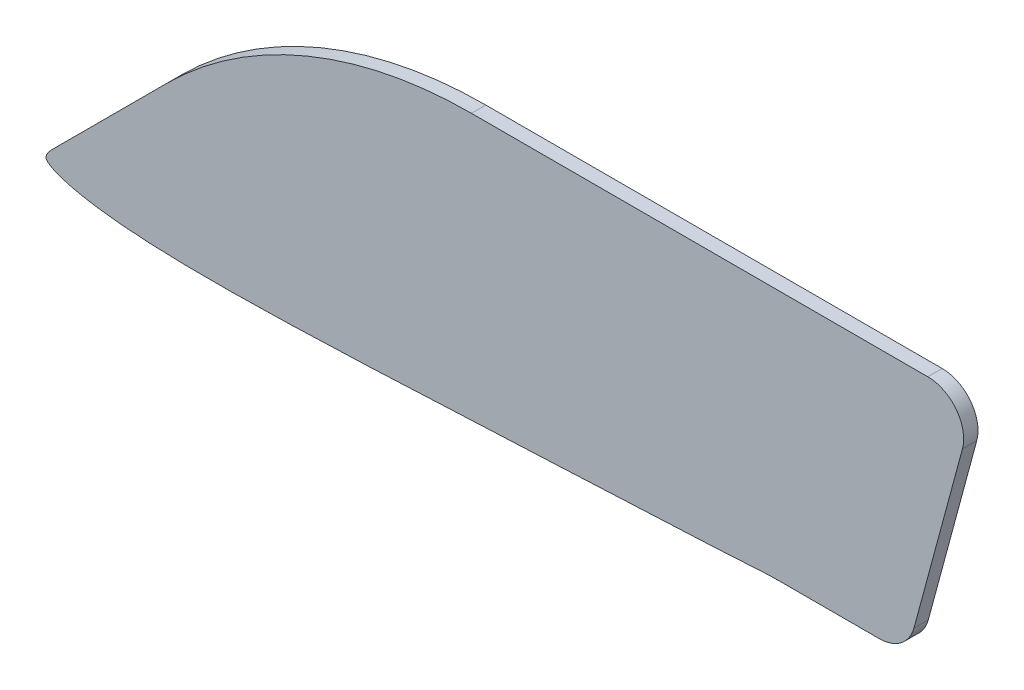
from build123d import *

# Parameters (mm, degrees)
BOSS_EXTRUDE1_DEPTH = 2
FILLET1_R           = 60
FILLET2_R           = 5


with BuildPart() as part:
    # Sketch1 → Boss-Extrude1 (new body)
    with BuildSketch(Plane.XY):
        with BuildLine():
            Line((254.454224585, 35), (220.765620284, 1.3113957))
            add(Edge.make_bspline(
                [(220.765620284, 1.3113957), (220.72663316, 1.272408575), (220.493626624, 1.032206135), (220.23379921, 0.706351654), (220.061642382, 0.318391358), (220.011602189, 0.139502643), (219.995925197, -0.002861211), (220.008120727, -0.115534154), (220.062041002, -0.21843611), (220.160266844, -0.337962224), (220.314496952, -0.477861912), (220.482600839, -0.598911233), (220.942116034, -0.893723302), (221.892375739, -1.29761444), (223.520457756, -1.784013523), (225.623980896, -2.227885385), (228.177131144, -2.613315253), (231.164121123, -2.919183773), (234.563486569, -3.13704422), (238.352012883, -3.267079886), (242.499561211, -3.312040739), (246.9689457, -3.284920505), (251.715996006, -3.193186176), (256.691386013, -3.047617228), (261.841513678, -2.857541871), (267.108766757, -2.638288597), (272.431487903, -2.398822278), (277.745717707, -2.151491009), (282.986461691, -1.901966392), (288.089354259, -1.658423301), (292.991669653, -1.423290263), (297.633381787, -1.201968071), (301.957838568, -0.995171113), (305.91027468, -0.808454245), (309.445141673, -0.639954363), (312.505114519, -0.492661458), (315.08917453, -0.359561985), (317.064072102, -0.250243866), (318.667228537, -0.135455891), (319.33987673, -0.063054382), (319.997867718, -0.003800804), (320, 0)],
                knots=[0.495962564, 0.495962564, 0.495962564, 0.495962564, 0.496775026, 0.500888993, 0.502031934, 0.503032492, 0.503621391, 0.504143577, 0.504679782, 0.505310677, 0.506426476, 0.507746346, 0.508370255, 0.514496902, 0.522891546, 0.533497445, 0.54624431, 0.561059304, 0.577878564, 0.59660209, 0.617103044, 0.639204159, 0.662685634, 0.687304872, 0.712801248, 0.738887215, 0.765254171, 0.791582967, 0.817548904, 0.842831994, 0.867120728, 0.890117968, 0.911543748, 0.931132077, 0.948635559, 0.963834135, 0.976537414, 0.986586626, 0.993888175, 0.998423524, 1, 1, 1, 1], degree=3))
            Line((320, 0), (340.000065011, 0))
            Line((340.000065011, 0), (349.454224585, 35))
            Line((349.454224585, 35), (254.454224585, 35))
        make_face()
    extrude(amount=BOSS_EXTRUDE1_DEPTH)

    # Fillet1
    fillet1_edges = [part.edges().sort_by_distance(p)[0] for p in [
        (320, 0, 1),
        (254.454224585, 35, 1),
    ]]
    fillet(fillet1_edges, radius=FILLET1_R)

    # Fillet2
    fillet2_edges = [part.edges().sort_by_distance(p)[0] for p in [
        (349.454224585, 35, 1),
        (340.000065011, 0, 1),
    ]]
    fillet(fillet2_edges, radius=FILLET2_R)


solid = part.part
